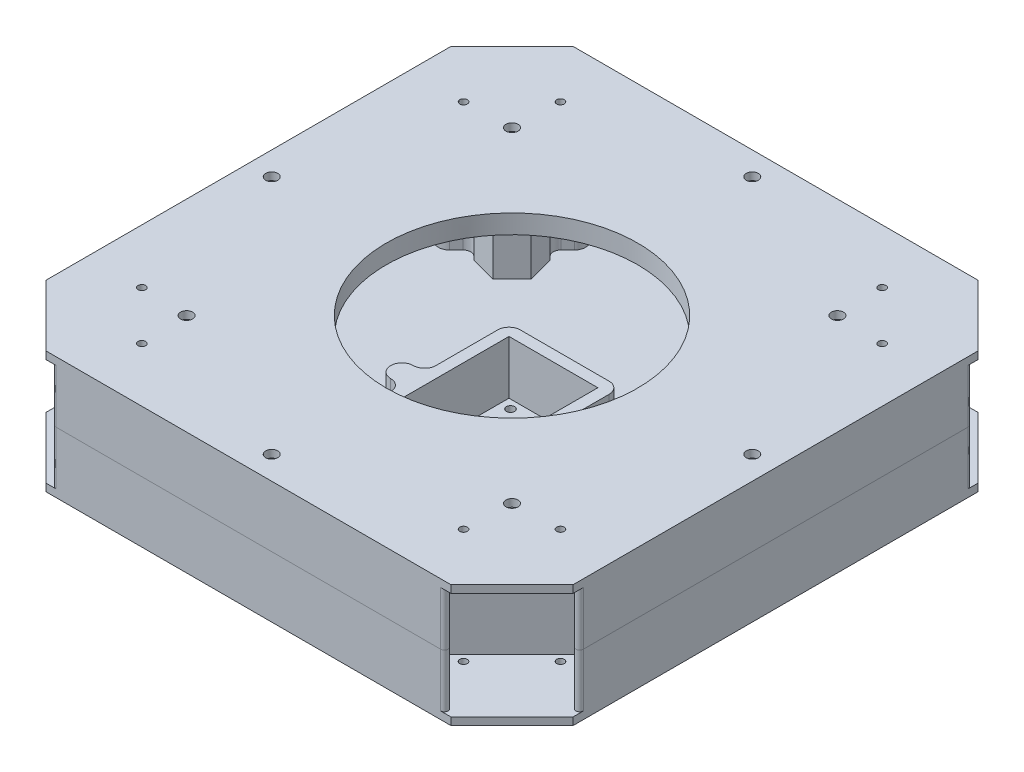
from build123d import *

# Parameters (mm, degrees)
SKETCH1_R            = 1
BOSS_EXTRUDE1_DEPTH  = 2
BOSS_EXTRUDE2_DEPTH  = 14.2
FILLET1_R            = 3
BOSS_EXTRUDE3_DEPTH  = 14.2
FILLET2_R            = 2
FILLET3_R            = 1
BOSS_EXTRUDE4_DEPTH  = 14.2
BOSS_EXTRUDE5_DEPTH  = 14.2
SKETCH8_R            = 1.6
CUT_EXTRUDE1_DEPTH   = 101.008199664
FILLET4_R            = 2
CIRPATTERN1_COUNT    = 4
SKETCH10_W           = 29.6
SKETCH10_H           = 50.8
SKETCH10_W_2         = 23.6
SKETCH10_H_2         = 44.8
BOSS_EXTRUDE6_DEPTH  = 14.2
SKETCH11_R           = 1.1
SKETCH11_R_2         = 5
CUT_EXTRUDE2_DEPTH   = 104.557520248
SKETCH13_W           = 6
SKETCH13_H           = 6
BOSS_EXTRUDE7_DEPTH  = 14.2
SKETCH14_W           = 3
SKETCH14_H           = 23.8
BOSS_EXTRUDE8_DEPTH  = 14.2
FILLET5_R            = 3
SKETCH16_W           = 18
SKETCH16_H           = 10
CUT_EXTRUDE3_DEPTH   = 104.557520248
SKETCH18_R           = 33.372530525
CUT_EXTRUDE5_DEPTH   = 105.162181237
SKETCH19_R           = 34.972530525
SKETCH19_R_2         = 33.372530525
BOSS_EXTRUDE10_DEPTH = 3
CHAMFER1_SIZE        = 3


# Some blends are built 0.0001 mm under size
with BuildPart() as part:
    # Sketch1 → Boss-Extrude1 (new body)
    with BuildSketch(Plane(origin=(0, 0, 0), x_dir=(1, 0, 0), z_dir=(0, 1, 0))):
        Polygon((0, 0), (0, 70), (53.736544033, 70), (70, 53.736544033), (70, 0), align=None)
        with Locations(Location((42.705678246, 55.575021664, 0), (0, 0, 270))):
            Circle(SKETCH1_R, mode=Mode.SUBTRACT)
        with Locations(Location((55.575021664, 42.705678246, 0), (0, 0, 270))):
            Circle(SKETCH1_R, mode=Mode.SUBTRACT)
    extrude(amount=BOSS_EXTRUDE1_DEPTH)

    # Sketch4 → Boss-Extrude2 (add)
    with BuildSketch(Plane(origin=(0, 2, 0), x_dir=(1, 0, 0), z_dir=(0, 1, 0))):
        Polygon((49.211060633, 70), (35.068925009, 55.857864376), (55.857864376, 35.068925009), (70, 49.211060633), (70, 53.45370132), (55.857864376, 39.311565697), (39.311565697, 55.857864376), (53.45370132, 70), align=None)
    extrude(amount=BOSS_EXTRUDE2_DEPTH)

    # Fillet1
    fillet1_edges = [part.edges().sort_by_distance(p)[0] for p in [
        (35.068925009, 9.1, -55.857864376),
        (55.857864376, 9.1, -35.068925009),
    ]]
    fillet(fillet1_edges, radius=FILLET1_R)

    # Sketch5 → Boss-Extrude3 (add)
    with BuildSketch(Plane(origin=(0, 2, 0), x_dir=(1, 0, 0), z_dir=(0, 1, 0))):
        Polygon((0, 70), (49.211060633, 70), (46.211060633, 67), (0, 67), align=None)
        Polygon((67, 46.211060633), (67, 0), (70, 0), (70, 49.211060633), align=None)
    extrude(amount=BOSS_EXTRUDE3_DEPTH)

    # Fillet2
    fillet2_edges = [part.edges().sort_by_distance(p)[0] for p in [
        (46.211060633, 9.1, -67),
        (67, 9.1, -46.211060633),
    ]]
    fillet(fillet2_edges, radius=FILLET2_R)

    # Fillet3
    fillet3_edges = [part.edges().sort_by_distance(p)[0] for p in [
        (53.45370132, 9.1, -70),
        (70, 9.1, -53.45370132),
    ]]
    fillet(fillet3_edges, radius=FILLET3_R)

    # Sketch6 → Boss-Extrude4 (add)
    with BuildSketch(Plane(origin=(0, 2, 0), x_dir=(1, 0, 0), z_dir=(0, 1, 0))):
        Polygon((45.813442052, 40.587863934), (46.769789222, 44.157000163), (50.525673495, 40.401115891), (48.262931795, 38.138374191), (41.347730351, 36.285451549), (36.285451549, 41.347730351), (38.138374191, 48.262931795), (40.401115891, 50.525673495), (44.157000163, 46.769789222), (40.587863934, 45.813442052), (39.631516764, 42.244305823), (42.244305823, 39.631516764), align=None)
    extrude(amount=BOSS_EXTRUDE4_DEPTH)

    # Sketch7 → Boss-Extrude5 (add)
    with BuildSketch(Plane(origin=(0, 2, 0), x_dir=(1, 0, 0), z_dir=(0, 1, 0))):
        Polygon((3.695041723, 63.8), (1.847520861, 67), (7.159143338, 67), (7.159143338, 63.8), (3.579571669, 57.6), (0, 57.6), (0, 60.6), (1.847520861, 60.6), align=None)
        Polygon((60.6, 1.847520861), (63.8, 3.695041723), (67, 1.847520861), (67, 7.159143338), (63.8, 7.159143338), (57.6, 3.579571669), (57.6, 0), (60.6, 0), align=None)
    extrude(amount=BOSS_EXTRUDE5_DEPTH)

    # Sketch8 → Cut-Extrude1 (cut, through all)
    with BuildSketch(Plane(origin=(0, 2, 0), x_dir=(1, 0, 0), z_dir=(0, 1, 0))):
        with Locations(Location((43.200652993, 43.200652993, 0), (0, 0, 270))):
            Circle(SKETCH8_R)
        with Locations((0, 63.8)):
            Circle(SKETCH8_R)
        with Locations((63.8, 0)):
            Circle(SKETCH8_R)
    extrude(amount=-CUT_EXTRUDE1_DEPTH, mode=Mode.SUBTRACT)

    # Fillet4
    # the kernel refuses this fillet: 2 mm, written as the material it adds along each edge
    with BuildSketch(Plane(origin=(40.401115891, 2, -50.525673495), x_dir=(-0.7071067811865476, 0, 0.7071067811865476), z_dir=(0, 1, 0)), Plane(origin=(50.525673495, 2, -40.401115891), x_dir=(0.7071067811865476, 0, 0.7071067811865476), z_dir=(0, 1, 0)), Plane(origin=(7.159143338, 2, -67), x_dir=(1, 0, 0), z_dir=(0, 1, 0)), Plane(origin=(67, 2, -7.159143338), x_dir=(-1.0, 0, -1.5439205468965806e-11), z_dir=(0, 1, 0))) as fillet4_piece_1:
        with BuildLine():
            CenterArc((FILLET4_R, -FILLET4_R), FILLET4_R, 90, 90)
            Line((0, -FILLET4_R), (0, 0))
            Line((0, 0), (FILLET4_R, 0))
        make_face()
    extrude(amount=14.2)


with BuildPart() as cirpattern1_1:
    # CirPattern1: pattern copy
    add(part.part.rotate(Axis((0, 0, 0), (0, 1, 0)), 1 * 360 / CIRPATTERN1_COUNT))


with BuildPart() as cirpattern1_2:
    # CirPattern1: pattern copy
    add(part.part.rotate(Axis((0, 0, 0), (0, 1, 0)), 2 * 360 / CIRPATTERN1_COUNT))


with BuildPart() as cirpattern1_3:
    # CirPattern1: pattern copy
    add(part.part.rotate(Axis((0, 0, 0), (0, 1, 0)), 3 * 360 / CIRPATTERN1_COUNT))


with BuildPart() as part_1:
    add(part.part)

    # Combine1: union CirPattern1_1, CirPattern1_2, CirPattern1_3
    add(cirpattern1_1.part)
    add(cirpattern1_2.part)
    add(cirpattern1_3.part)


with BuildPart() as body_2:
    # Mirror1: mirrored copy
    add(part_1.part.mirror(Plane.ZX.offset(16.2)))

    # Sketch18 → Cut-Extrude5 (cut, through all)
    with BuildSketch(Plane(origin=(0, 32.4, 0), x_dir=(1, 0, 0), z_dir=(0, 1, 0))):
        with Locations(Location((0, 0, 0), (0, 0, 270))):
            Circle(SKETCH18_R)
    extrude(amount=-CUT_EXTRUDE5_DEPTH, mode=Mode.SUBTRACT)

    # Sketch19 → Boss-Extrude10 (add)
    with BuildSketch(Plane.XZ.offset(-30.4)):
        with Locations(Location((0, 0, 0), (0, 0, 90))):
            Circle(SKETCH19_R)
        with Locations(Location((0, 0, 0), (0, 0, 90))):
            Circle(SKETCH19_R_2, mode=Mode.SUBTRACT)
    extrude(amount=BOSS_EXTRUDE10_DEPTH)

    # Chamfer1
    chamfer1_edges = [body_2.edges().sort_by_distance(p)[0] for p in [
        (0, 30.4, -34.972530525),
    ]]
    chamfer(chamfer1_edges, length=CHAMFER1_SIZE - 0.0001)  # a hair under: the kernel refuses the full size


with BuildPart() as part_2:
    add(part_1.part)

    # Sketch10 → Boss-Extrude6 (add)
    with BuildSketch(Plane(origin=(0, 2, 0), x_dir=(1, 0, 0), z_dir=(0, 1, 0))):
        with Locations((0, -11.4)):
            Rectangle(SKETCH10_W, SKETCH10_H)
        with Locations((0, -11.4)):
            Rectangle(SKETCH10_W_2, SKETCH10_H_2, mode=Mode.SUBTRACT)
    extrude(amount=BOSS_EXTRUDE6_DEPTH)

    # Sketch11 → Cut-Extrude2 (cut, through all)
    with BuildSketch(Plane(origin=(0, 2, 0), x_dir=(1, 0, 0), z_dir=(0, 1, 0))):
        with Locations(Location((-9.1, 8.7, 0), (0, 0, 270))):
            Circle(SKETCH11_R)
        with Locations(Location((9.1, 8.7, 0), (0, 0, 270))):
            Circle(SKETCH11_R)
        with Locations(Location((9.1, -31.5, 0), (0, 0, 270))):
            Circle(SKETCH11_R)
        with Locations(Location((-9.1, -31.5, 0), (0, 0, 270))):
            Circle(SKETCH11_R)
        with Locations(Location((0, 0, 0), (0, 0, 270))):
            Circle(SKETCH11_R_2)
    extrude(amount=-CUT_EXTRUDE2_DEPTH, mode=Mode.SUBTRACT)

    # Sketch13 → Boss-Extrude7 (add)
    with BuildSketch(Plane(origin=(0, 2, 0), x_dir=(1, 0, 0), z_dir=(0, 1, 0))):
        with Locations((-17.8, -11.4)):
            Rectangle(SKETCH13_W, SKETCH13_H)
        with Locations((17.8, -11.4)):
            Rectangle(SKETCH13_W, SKETCH13_H)
    extrude(amount=BOSS_EXTRUDE7_DEPTH)

    # Sketch14 → Boss-Extrude8 (add)
    with BuildSketch(Plane(origin=(0, 2, 0), x_dir=(1, 0, 0), z_dir=(0, 1, 0))):
        with Locations((0, -45.7)):
            Rectangle(SKETCH14_W, SKETCH14_H)
    extrude(amount=BOSS_EXTRUDE8_DEPTH)

    # Fillet5
    fillet5_edges = [part_2.edges().sort_by_distance(p)[0] for p in [
        (-14.8, 9.1, 36.8),
        (14.8, 9.1, 36.8),
        (14.8, 9.1, -14),
        (-14.8, 9.1, -14),
        (14.8, 9.1, 14.4),
        (20.8, 9.1, 14.4),
        (20.8, 9.1, 8.4),
        (14.8, 9.1, 8.4),
        (-14.8, 9.1, 8.4),
        (-20.8, 9.1, 8.4),
        (-20.8, 9.1, 14.4),
        (-14.8, 9.1, 14.4),
        (1.5, 9.1, 36.8),
        (-1.5, 9.1, 36.8),
    ]]
    fillet(fillet5_edges, radius=FILLET5_R - 0.0001)  # a hair under: the kernel refuses the full size

    # Sketch16 → Cut-Extrude3 (cut, through all)
    with BuildSketch(Plane(origin=(0, 2, 0), x_dir=(1, 0, 0), z_dir=(0, 1, 0))):
        with Locations((0, -11.5)):
            Rectangle(SKETCH16_W, SKETCH16_H)
    extrude(amount=-CUT_EXTRUDE3_DEPTH, mode=Mode.SUBTRACT)


solid = Compound([body_2.part, part_2.part])
